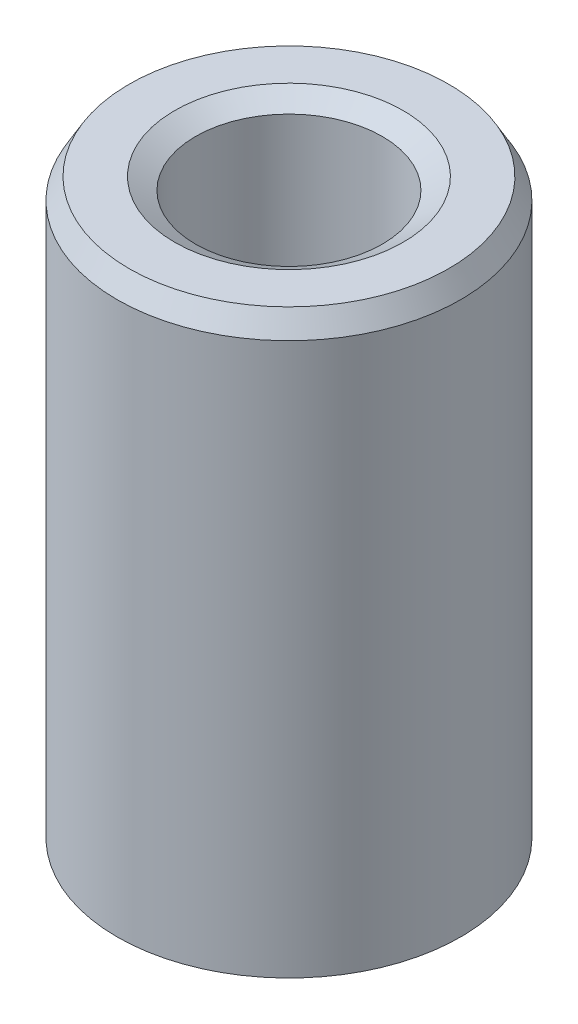
from build123d import *
from OCP.BRepFilletAPI import BRepFilletAPI_MakeChamfer

# Parameters (mm, degrees)
SKETCH1_R           = 32.5
BOSS_EXTRUDE1_DEPTH = 110.609771311
SKETCH2_R           = 17.659988184
CUT_EXTRUDE1_DEPTH  = 120.779052883
CHAMFER1_SIZE       = 3.939517371
CHAMFER1_SIZE2      = 2.274481415


with BuildPart() as part:
    # Sketch1 → Boss-Extrude1 (new body)
    with BuildSketch(Plane(origin=(0, 0, 0), x_dir=(1, 0, 0), z_dir=(0, 1, 0))):
        Circle(SKETCH1_R)
    extrude(amount=BOSS_EXTRUDE1_DEPTH)

    # Sketch2 → Cut-Extrude1 (cut, through all)
    with BuildSketch(Plane(origin=(0, 0, 0), x_dir=(1, 0, 0), z_dir=(0, 1, 0))):
        Circle(SKETCH2_R)
    extrude(amount=CUT_EXTRUDE1_DEPTH, mode=Mode.SUBTRACT)

    # Chamfer1: one chamfer whose edges measure the first distance from different faces: ONE call of the kernel's chamfer builder (chamfer() names one face for all edges)
    chamfer1_edges_1 = [part.edges().sort_by_distance(p)[0] for p in [
        (-17.659988184, 110.609771311, 0),
    ]]
    chamfer1_side_1 = [part.faces().sort_by_distance(p)[0] for p in [
        (-31.580761184, 110.609771311, 0),
    ]]
    chamfer1_edges_2 = [part.edges().sort_by_distance(p)[0] for p in [
        (-17.659988184, 0, 0),
    ]]
    chamfer1_side_2 = [part.faces().sort_by_distance(p)[0] for p in [
        (-17.659988184, 55.304885656, 0),
    ]]
    chamfer1_edges_3 = [part.edges().sort_by_distance(p)[0] for p in [
        (-32.5, 0, 0),
    ]]
    chamfer1_side_3 = [part.faces().sort_by_distance(p)[0] for p in [
        (-31.580761184, 0, 0),
    ]]
    chamfer1_edges_4 = [part.edges().sort_by_distance(p)[0] for p in [
        (-32.5, 110.609771311, 0),
    ]]
    chamfer1_side_4 = [part.faces().sort_by_distance(p)[0] for p in [
        (-32.5, 55.304885656, 0),
    ]]
    chamfer1 = BRepFilletAPI_MakeChamfer(part.part.solid().wrapped)
    for e in chamfer1_edges_1:
        chamfer1.Add(CHAMFER1_SIZE, CHAMFER1_SIZE2, e.wrapped, chamfer1_side_1[0].wrapped)  # the first distance lies on this face
    for e in chamfer1_edges_2:
        chamfer1.Add(CHAMFER1_SIZE, CHAMFER1_SIZE2, e.wrapped, chamfer1_side_2[0].wrapped)  # the first distance lies on this face
    for e in chamfer1_edges_3:
        chamfer1.Add(CHAMFER1_SIZE, CHAMFER1_SIZE2, e.wrapped, chamfer1_side_3[0].wrapped)  # the first distance lies on this face
    for e in chamfer1_edges_4:
        chamfer1.Add(CHAMFER1_SIZE, CHAMFER1_SIZE2, e.wrapped, chamfer1_side_4[0].wrapped)  # the first distance lies on this face
    add(Compound.cast(chamfer1.Shape()), mode=Mode.REPLACE)


solid = part.part
